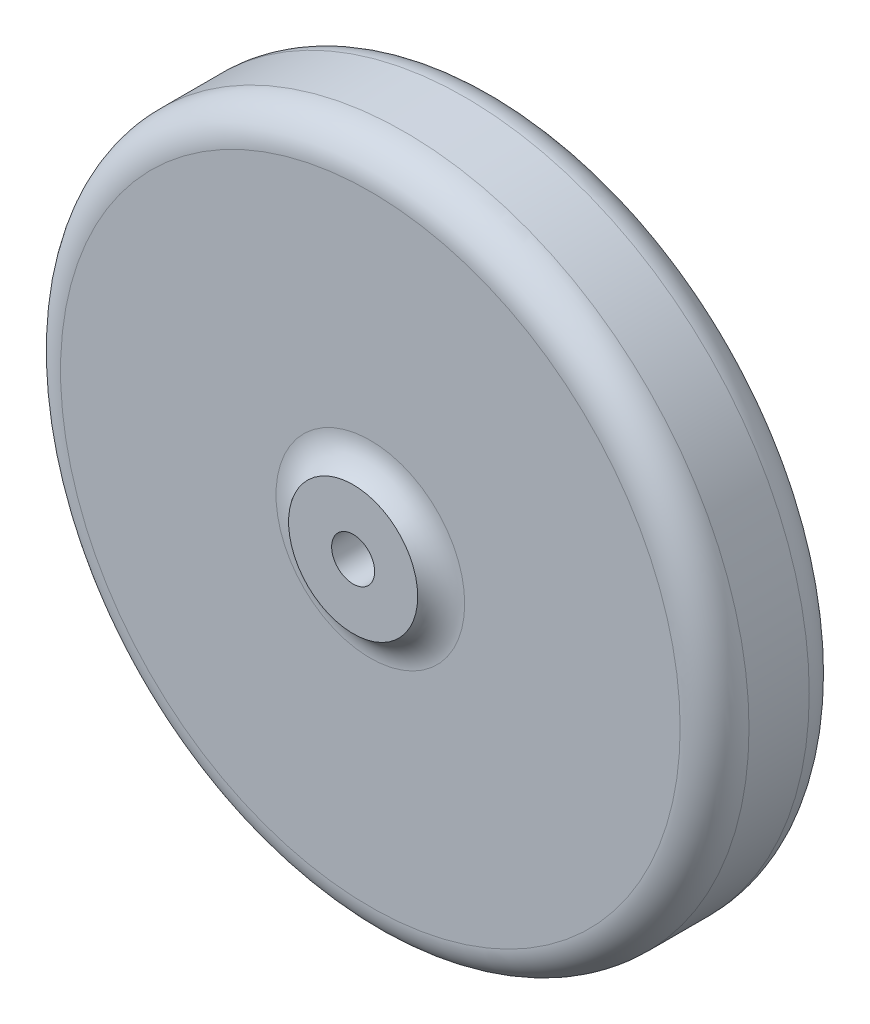
from build123d import *

# Parameters (mm, degrees)
SKETCH1_R               = 63.5
BOSS_EXTRUDE1_DEPTH     = 11.90625
SKETCH2_R               = 11.90625
BOSS_EXTRUDE2_DEPTH     = 15.08125
CUT_EXTRUDE1_DEPTH      = 92.060112572
CUT_EXTRUDE1_DEPTH_BACK = 92.060112572
SKETCH3_R               = 3.96875
FILLET1_R               = 6.35


with BuildPart() as part:
    # Sketch1 → Boss-Extrude1 (new, symmetric)
    with BuildSketch(Plane.XY):
        Circle(SKETCH1_R)
    extrude(amount=BOSS_EXTRUDE1_DEPTH, both=True)

    # Sketch2 → Boss-Extrude2 (add, symmetric)
    with BuildSketch(Plane.XY):
        with Locations(Location((0, 0, 0), (0, 0, 180))):
            Circle(SKETCH2_R)
    extrude(amount=BOSS_EXTRUDE2_DEPTH, both=True)

    # Sketch3 → Cut-Extrude1 (cut, two sides: drawn at the far end of the back side and taken through both)
    with BuildSketch(Plane.XY.offset(-CUT_EXTRUDE1_DEPTH_BACK)):
        Circle(SKETCH3_R)
    extrude(amount=CUT_EXTRUDE1_DEPTH + CUT_EXTRUDE1_DEPTH_BACK, mode=Mode.SUBTRACT)

    # Fillet1
    # the kernel refuses this fillet: 6.35 mm, written as the material it adds along each edge
    with BuildSketch(Plane(origin=(0, 0, -11.90625), x_dir=(-1, 0, 0), z_dir=(0, 1, 0))) as fillet1_piece_1:
        with BuildLine():
            CenterArc((17.405511314, -6.35), FILLET1_R, 90, 60)
            Line((17.405511314, 0), (11.90625, 0))
            Line((11.90625, 0), (11.90625, -3.175))
        make_face()
    revolve(axis=Axis((0, 0, -11.90625), (0, 0, 1)))
    with BuildSketch(Plane(origin=(0, 0, 11.90625), x_dir=(-1, 0, 0), z_dir=(0, 1, 0))) as fillet1_piece_2:
        with BuildLine():
            CenterArc((17.405511314, 6.35), FILLET1_R, 210, 60)
            Line((11.90625, 3.175), (11.90625, 0))
            Line((11.90625, 0), (17.405511314, 0))
        make_face()
    revolve(axis=Axis((0, 0, 11.90625), (0, 0, 1)))
    # the kernel refuses this fillet: 6.35 mm, written as the material it takes off along each edge
    with BuildSketch(Plane(origin=(0, 0, -11.90625), x_dir=(1, 0, 0), z_dir=(0, -1, 0))) as fillet1_2_piece_1:
        with BuildLine():
            CenterArc((63.5 - FILLET1_R, FILLET1_R), FILLET1_R, 270, 90)
            Line((63.5 - FILLET1_R, 0), (63.5, 0))
            Line((63.5, 0), (63.5, FILLET1_R))
        make_face()
    revolve(axis=Axis((0, 0, -11.90625), (0, 0, 1)), mode=Mode.SUBTRACT)
    with BuildSketch(Plane(origin=(0, 0, 11.90625), x_dir=(1, 0, 0), z_dir=(0, -1, 0))) as fillet1_2_piece_2:
        with BuildLine():
            CenterArc((63.5 - FILLET1_R, -FILLET1_R), FILLET1_R, 0, 90)
            Line((63.5 - FILLET1_R, 0), (63.5, 0))
            Line((63.5, 0), (63.5, -FILLET1_R))
        make_face()
    revolve(axis=Axis((0, 0, 11.90625), (0, 0, 1)), mode=Mode.SUBTRACT)


solid = part.part
